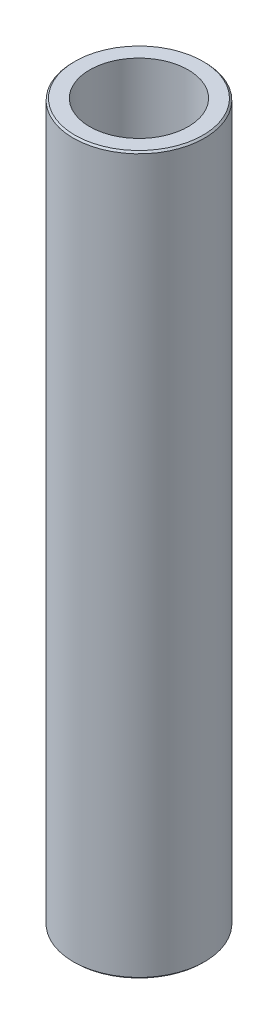
from build123d import *

# Parameters (mm, degrees)
SKETCH1_R           = 55
BOSS_EXTRUDE1_DEPTH = 600
SKETCH2_R           = 41.236095193
CUT_EXTRUDE1_DEPTH  = 606.020660804
CHAMFER1_SIZE       = 1.402518851


with BuildPart() as part:
    # Sketch1 → Boss-Extrude1 (new body)
    with BuildSketch(Plane(origin=(0, 0, 0), x_dir=(1, 0, 0), z_dir=(0, 1, 0))):
        Circle(SKETCH1_R)
    extrude(amount=BOSS_EXTRUDE1_DEPTH)

    # Sketch2 → Cut-Extrude1 (cut, through all)
    with BuildSketch(Plane(origin=(0, 0, 0), x_dir=(1, 0, 0), z_dir=(0, 1, 0))):
        Circle(SKETCH2_R)
    extrude(amount=CUT_EXTRUDE1_DEPTH, mode=Mode.SUBTRACT)

    # Chamfer1
    chamfer1_edges = [part.edges().sort_by_distance(p)[0] for p in [
        (-55, 600, 0),
        (-55, 0, 0),
    ]]
    chamfer(chamfer1_edges, length=CHAMFER1_SIZE)


solid = part.part
